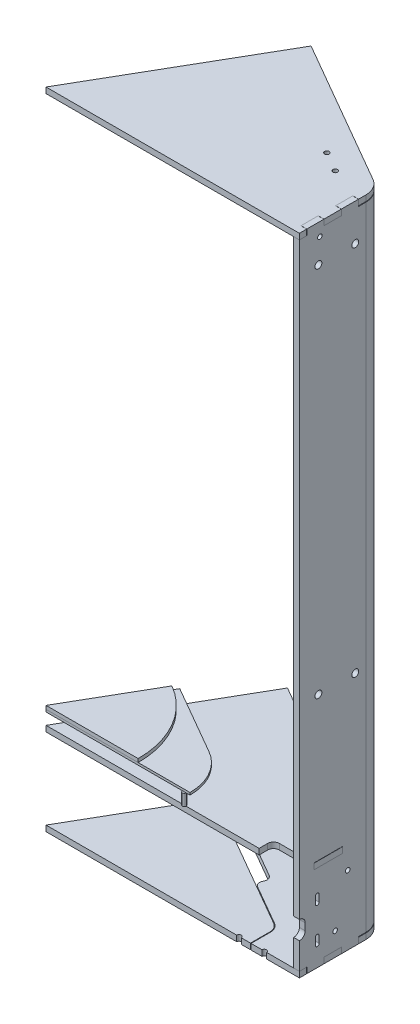
from build123d import *

# Parameters (mm, degrees)
SKETCH2_W             = 5
SKETCH2_H             = 350
BOSS_EXTRUDE1_START   = -95
BOSS_EXTRUDE1_DEPTH   = 5
FILLET1_R             = 17
THICKEN1_START        = -90
THICKEN1_DEPTH        = 550
BOSS_EXTRUDE7_DEPTH   = 5
SKETCH5_W             = 5
SKETCH5_H             = 15
CUT_EXTRUDE1_DEPTH    = 620.098738942
BOSS_EXTRUDE2_REACH   = 621.099
SKETCH7_W             = 5
SKETCH7_H             = 14.8
SKETCH22_W            = 35.037696658
SKETCH22_H            = 0.5
CUT_EXTRUDE8_DEPTH    = 535.703888671
BOSS_EXTRUDE3_DEPTH   = 3
BOSS_EXTRUDE4_DEPTH   = 2
SKETCH10_R            = 120
SKETCH10_R_2          = 80
CUT_EXTRUDE2_DEPTH    = 535.703888671
SKETCH11_R            = 1.625
BOSS_EXTRUDE5_DEPTH   = 10
BOSS_EXTRUDE6_DEPTH   = 5
CUT_EXTRUDE21_DEPTH   = 548.798547424
SKETCH13_W            = 25
SKETCH13_H            = 5.2
CUT_EXTRUDE4_DEPTH    = 535.703888671
CUT_EXTRUDE5_DEPTH    = 10
SKETCH21_R            = 2
CUT_EXTRUDE7_DEPTH    = 533.666169903
SKETCH24_W            = 121.884572681
SKETCH24_H            = 40
BOSS_EXTRUDE8_DEPTH   = 5
SKETCH24_H_2          = 74.75
BOSS_EXTRUDE8_2_DEPTH = 5
SKETCH27_R            = 2
SKETCH27_R_2          = 3
CUT_EXTRUDE10_DEPTH   = 5
SKETCH25_R            = 2
CUT_EXTRUDE9_DEPTH    = 615.579733281
SKETCH41_R            = 2
CUT_EXTRUDE22_DEPTH   = 620.098738942
CUT_EXTRUDE23_DEPTH   = 620.098738942
CUT_EXTRUDE6_DEPTH    = 10
FILLET2_R             = 5
SKETCH43_R            = 2
CUT_EXTRUDE24_DEPTH   = 620.098738942
SKETCH28_R            = 2
CUT_EXTRUDE11_DEPTH   = 620.098738942
SKETCH29_R            = 2
CUT_EXTRUDE12_DEPTH   = 506.811549291
SKETCH31_R            = 2
CUT_EXTRUDE14_DEPTH   = 548.798547424
SKETCH30_W            = 121.884572681
SKETCH30_H            = 549.5
SKETCH30_R            = 2
BOSS_EXTRUDE9_DEPTH   = 5
SKETCH32_W            = 40
SKETCH32_H            = 28
BOSS_EXTRUDE10_DEPTH  = 28
CUT_EXTRUDE15_DEPTH   = 522.844237142
SKETCH34_W            = 14.5
SKETCH34_H            = 24
CUT_EXTRUDE16_DEPTH   = 24
SKETCH35_R            = 2
CUT_EXTRUDE17_DEPTH   = 506.811549291
BOSS_EXTRUDE11_DEPTH  = 3
CHAMFER1_SIZE         = 2.75
BOSS_EXTRUDE12_DEPTH  = 0.5
CUT_EXTRUDE18_DEPTH   = 1
CHAMFER2_SIZE         = 0.25
CUT_EXTRUDE20_DEPTH   = 522.844237142


# Read off the part's stored shape, not the designer's step: Thicken1
with BuildPart() as part:
    # Sketch2 → Revolve1 (revolve)
    with BuildSketch(Plane(origin=(195, 0, 0), x_dir=(0, 0, -1), z_dir=(1, 0, 0))):
        with Locations((30, 275)):
            Rectangle(SKETCH2_W, SKETCH2_H)
    revolve(axis=Axis((195, 450, -32.5), (0, -1, 0)))


with BuildPart() as body_2:
    # Sketch3 → Boss-Extrude1 (new body)
    with BuildSketch(Plane(origin=(0, 0, 0), x_dir=(1, 0, 0), z_dir=(0, 1, 0)).offset(BOSS_EXTRUDE1_START)):
        Polygon((220, 67.5), (84.228357378, 145.887794416), (0, 0), (220, 0), (220, 32.5), align=None)
    extrude(amount=BOSS_EXTRUDE1_DEPTH)

    # Fillet1
    fillet1_edges = [body_2.edges().sort_by_distance(p)[0] for p in [
        (220, -92.5, -67.5),
    ]]
    fillet(fillet1_edges, radius=FILLET1_R)


with BuildPart() as body_3:
    # Thicken1 outline → Thicken1 (new body)
    with BuildSketch(Plane(origin=(0, 0, 0), x_dir=(1, 0, 0), z_dir=(0, 1, 0)).offset(THICKEN1_START)):
        with BuildLine():
            Line((215, 57.685045424), (215, 0))
            Line((215, 0), (220, 0))
            Line((220, 0), (220, 57.685045424))
            ThreePointArc((220, 57.685045424), (217.722431864, 66.185045424), (211.5, 72.407477288))
            Line((211.5, 72.407477288), (190, 84.820508076))
            Line((190, 84.820508076), (187.5, 80.490381057))
            Line((187.5, 80.490381057), (209, 68.077350269))
            ThreePointArc((209, 68.077350269), (213.392304845, 63.685045424), (215, 57.685045424))
        make_face()
    extrude(amount=THICKEN1_DEPTH)



with BuildPart() as body_4:
    # Sketch23 → Boss-Extrude7 (new body)
    with BuildSketch(Plane(origin=(0, 460, 0), x_dir=(1, 0, 0), z_dir=(0, 1, 0))):
        with BuildLine():
            Line((220, 0), (220, 57.685045424))
            ThreePointArc((220, 57.685045424), (217.722431864, 66.185045424), (211.5, 72.407477288))
            Line((211.5, 72.407477288), (84.228357378, 145.887794416))
            Line((84.228357378, 145.887794416), (0, 0))
            Line((0, 0), (220, 0))
        make_face()
    extrude(amount=BOSS_EXTRUDE7_DEPTH)


with BuildPart() as cut_extrude1_tool:
    # Sketch5 → Cut-Extrude1 (new, through all)
    with BuildSketch(Plane.XZ.offset(95)):
        with Locations((217.5, -43.842522712)):
            Rectangle(SKETCH5_W, SKETCH5_H)
        with Locations((217.5, -13.842522712)):
            Rectangle(SKETCH5_W, SKETCH5_H)
    extrude(amount=-CUT_EXTRUDE1_DEPTH)


with BuildPart() as body_2_1:
    add(body_2.part)

    # Cut-Extrude1: cut by cut_extrude1_tool
    add(cut_extrude1_tool.part, mode=Mode.SUBTRACT)

    # Sketch25 → Cut-Extrude9 (cut, through all)
    with BuildSketch(Plane(origin=(0, -90, 0), x_dir=(1, 0, 0), z_dir=(0, 1, 0))):
        with Locations(Location((200, 31, 0), (0, 0, 270))):
            Circle(SKETCH25_R)
        with Locations((189.5, 0)):
            Circle(SKETCH25_R)
        with Locations(Location((188.660254038, 62.5, 0), (0, 0, 270))):
            Circle(SKETCH25_R)
        with Locations(Location((171.339745962, 72.5, 0), (0, 0, 270))):
            Circle(SKETCH25_R)
    extrude(amount=-CUT_EXTRUDE9_DEPTH, mode=Mode.SUBTRACT)

    # Sketch41 → Cut-Extrude22 (cut, through all)
    with BuildSketch(Plane.XZ.offset(95)):
        with Locations((167.5, 0)):
            Circle(SKETCH41_R)
    extrude(amount=-CUT_EXTRUDE22_DEPTH, mode=Mode.SUBTRACT)

    # Sketch42 → Cut-Extrude23 (cut, through all)
    with BuildSketch(Plane.XZ.offset(95)):
        with BuildLine():
            Line((177.5, -16.693176311), (177.5, 0))
            Line((177.5, 0), (178, 0))
            Line((178, 0), (178, -16.693176311))
            ThreePointArc((178, -16.693176311), (176.660254038, -21.693176311), (173, -25.353430349))
            Line((173, -25.353430349), (54.228357378, -93.926270189))
            Line((54.228357378, -93.926270189), (53.978357378, -93.493257487))
            Line((53.978357378, -93.493257487), (172.75, -24.920417647))
            ThreePointArc((172.75, -24.920417647), (176.227241336, -21.443176311), (177.5, -16.693176311))
        make_face()
    extrude(amount=-CUT_EXTRUDE23_DEPTH, mode=Mode.SUBTRACT)


with BuildPart() as body_4_1:
    add(body_4.part)

    # Cut-Extrude1: cut by cut_extrude1_tool
    add(cut_extrude1_tool.part, mode=Mode.SUBTRACT)


with BuildPart() as body_3_1:
    add(body_3.part)

    # Boss-Extrude2: up to this face of the body (flat: up to its plane)
    boss_extrude2_end = Plane(body_4_1.part.faces().sort_by_distance((116.890310956, 465, -53.798845766))[0])
    # Sketch7 → Boss-Extrude2 (add, up to the picked face)
    with BuildSketch(Plane.XZ.offset(95), mode=Mode.PRIVATE) as boss_extrude2_sk1:
        with Locations((217.5, -13.842522712)):
            Rectangle(SKETCH7_W, SKETCH7_H)
    boss_extrude2_tool1 = split(extrude(boss_extrude2_sk1.sketch, amount=-BOSS_EXTRUDE2_REACH, mode=Mode.PRIVATE), bisect_by=boss_extrude2_end, keep=Keep.BOTH, mode=Mode.PRIVATE)
    # Sketch7 → Boss-Extrude2 (add, up to the picked face)
    with BuildSketch(Plane.XZ.offset(95), mode=Mode.PRIVATE) as boss_extrude2_sk2:
        with Locations((217.5, -43.842522712)):
            Rectangle(SKETCH7_W, SKETCH7_H)
    boss_extrude2_tool2 = split(extrude(boss_extrude2_sk2.sketch, amount=-BOSS_EXTRUDE2_REACH, mode=Mode.PRIVATE), bisect_by=boss_extrude2_end, keep=Keep.BOTH, mode=Mode.PRIVATE)
    add(boss_extrude2_tool1.solids().sort_by(Axis((217.5, -95, -13.842523), (0, 1, 0)))[0])
    add(boss_extrude2_tool2.solids().sort_by(Axis((217.5, -95, -43.842523), (0, 1, 0)))[0])

    # Sketch22 → Cut-Extrude8 (cut, through all)
    with BuildSketch(Plane(origin=(220, 0, 0), x_dir=(0, 0, -1), z_dir=(1, 0, 0))):
        with Locations((68.761371041, -89.75)):
            Rectangle(SKETCH22_W, SKETCH22_H)
        with Locations((68.761371041, 459.75)):
            Rectangle(SKETCH22_W, SKETCH22_H)
    extrude(amount=-CUT_EXTRUDE8_DEPTH, mode=Mode.SUBTRACT)

    # Sketch13 → Cut-Extrude4 (cut, through all)
    with BuildSketch(Plane(origin=(220, 0, 0), x_dir=(0, 0, -1), z_dir=(1, 0, 0))):
        with Locations((25, -17.4)):
            Rectangle(SKETCH13_W, SKETCH13_H)
    extrude(amount=-CUT_EXTRUDE4_DEPTH, mode=Mode.SUBTRACT)

    # Sketch14 → Cut-Extrude5 (cut)
    with BuildSketch(Plane(origin=(220, 0, 0), x_dir=(0, 0, -1), z_dir=(1, 0, 0))):
        with BuildLine():
            Line((13.875, -40.5), (13.875, -46.5))
            ThreePointArc((13.875, -46.5), (15.5, -48.125), (17.125, -46.5))
            Line((17.125, -46.5), (17.125, -40.5))
            ThreePointArc((17.125, -40.5), (15.5, -38.875), (13.875, -40.5))
        make_face()
        with BuildLine():
            Line((17.125, -71.5), (17.125, -77.5))
            ThreePointArc((17.125, -77.5), (15.5, -79.125), (13.875, -77.5))
            Line((13.875, -77.5), (13.875, -71.5))
            ThreePointArc((13.875, -71.5), (15.5, -69.875), (17.125, -71.5))
        make_face()
        with BuildLine():
            Line((5, -56), (5, -62))
            ThreePointArc((5, -62), (0, -67), (-5, -62))
            Line((-5, -62), (-5, -56))
            ThreePointArc((-5, -56), (0, -51), (5, -56))
        make_face()
    extrude(amount=-CUT_EXTRUDE5_DEPTH, mode=Mode.SUBTRACT)

    # Sketch21 → Cut-Extrude7 (cut, through all)
    with BuildSketch(Plane.ZY.offset(-215)):
        with Locations((-31, -75)):
            Circle(SKETCH21_R)
    extrude(amount=-CUT_EXTRUDE7_DEPTH, mode=Mode.SUBTRACT)

    # Sketch27 → Cut-Extrude10 (cut)
    with BuildSketch(Plane.ZY.offset(-215)):
        with Locations((-17.75, 453.5)):
            Circle(SKETCH27_R)
        with Locations((-42, -35)):
            Circle(SKETCH27_R)
        with Locations((-48.5, 433)):
            Circle(SKETCH27_R_2)
        with Locations((-16.5, 433)):
            Circle(SKETCH27_R_2)
        with Locations((-16.5, 110)):
            Circle(SKETCH27_R_2)
        with Locations((-48.5, 110)):
            Circle(SKETCH27_R_2)
    extrude(amount=-CUT_EXTRUDE10_DEPTH, mode=Mode.SUBTRACT)


with BuildPart() as body_5:
    # Sketch8 → Boss-Extrude3 (new body)
    with BuildSketch(Plane(origin=(0, 0, 0), x_dir=(1, 0, 0), z_dir=(0, 1, 0))):
        with BuildLine():
            Line((100, 34.641016151), (40, 69.282032303))
            Line((40, 69.282032303), (0, 0))
            Line((0, 0), (120, 0))
            ThreePointArc((120, 0), (114.641016151, 20), (100, 34.641016151))
        make_face()
    extrude(amount=-BOSS_EXTRUDE3_DEPTH)

    # Sketch10 → Cut-Extrude2 (cut, through all)
    with BuildSketch(Plane(origin=(0, 0, 0), x_dir=(1, 0, 0), z_dir=(0, 1, 0))):
        Circle(SKETCH10_R)
        Circle(SKETCH10_R_2, mode=Mode.SUBTRACT)
    extrude(amount=-CUT_EXTRUDE2_DEPTH, mode=Mode.SUBTRACT)


with BuildPart() as body_6:
    # Sketch9 → Boss-Extrude4 (new body)
    with BuildSketch(Plane.XZ.offset(3)):
        with BuildLine():
            Line((125, 0), (0, 0))
            Line((0, 0), (42.5, -73.612159322))
            Line((42.5, -73.612159322), (102.5, -38.97114317))
            ThreePointArc((102.5, -38.97114317), (118.97114317, -22.5), (125, 0))
        make_face()
    extrude(amount=BOSS_EXTRUDE4_DEPTH)


with BuildPart() as body_7:
    # Sketch11 → Boss-Extrude5 (new body)
    with BuildSketch(Plane.XZ.offset(5)):
        with Locations(Location((120, 0, 0), (0, 0, 270))):
            Circle(SKETCH11_R)
    extrude(amount=BOSS_EXTRUDE5_DEPTH)


with BuildPart() as body_8:
    # Sketch12 → Boss-Extrude6 (new body)
    with BuildSketch(Plane.XZ.offset(15)):
        Polygon((215, -53.06624327), (76.728357378, -132.89741336), (0, 0), (215, 0), (215, -12.5), (220, -12.5), (220, -37.5), (215, -37.5), align=None)
    extrude(amount=BOSS_EXTRUDE6_DEPTH)

    # Sketch40 → Cut-Extrude21 (cut, through all)
    with BuildSketch(Plane(origin=(0, -15, 0), x_dir=(1, 0, 0), z_dir=(0, 1, 0))):
        with BuildLine():
            Line((215, 12.5), (190, 12.5))
            ThreePointArc((190, 12.5), (186.464466094, 11.035533906), (185, 7.5))
            Line((185, 7.5), (185, 0))
            Line((185, 0), (215, 0))
            Line((215, 0), (215, 12.5))
        make_face()
    extrude(amount=-CUT_EXTRUDE21_DEPTH, mode=Mode.SUBTRACT)

    # Sketch31 → Cut-Extrude14 (cut, through all)
    with BuildSketch(Plane(origin=(0, -15, 0), x_dir=(1, 0, 0), z_dir=(0, 1, 0))):
        with Locations(Location((200, 42, 0), (0, 0, 270))):
            Circle(SKETCH31_R)
        with Locations(Location((145.358983849, 87.5, 0), (0, 0, 270))):
            Circle(SKETCH31_R)
    extrude(amount=-CUT_EXTRUDE14_DEPTH, mode=Mode.SUBTRACT)


with BuildPart() as body_9:
    # Sketch24 → Boss-Extrude8 (new body)
    with BuildSketch(Plane(origin=(84.228357378, 0, -145.887794416), x_dir=(-0.8660254037844382, 0, -0.5000000000000007), z_dir=(0.5000000000000008, 0, -0.8660254037844383))):
        with Locations((-60.942286341, 439.75)):
            Rectangle(SKETCH24_W, SKETCH24_H)
    extrude(amount=-BOSS_EXTRUDE8_DEPTH)


with BuildPart() as body_10:
    # Sketch24 → Boss-Extrude8 2 (new body)
    with BuildSketch(Plane(origin=(84.228357378, 0, -145.887794416), x_dir=(-0.8660254037844382, 0, -0.5000000000000007), z_dir=(0.5000000000000008, 0, -0.8660254037844383))):
        with Locations((-60.942286341, -52.375)):
            Rectangle(SKETCH24_W, SKETCH24_H_2)
    extrude(amount=-BOSS_EXTRUDE8_2_DEPTH)


with BuildPart() as cut_extrude23_piece_1:
    # of the separate pieces the step leaves, piece 1, a body of its own (cut_extrude23_pieces)
    add(body_2_1.part.solids().sort_by_distance((211.5, -95, -72.407477288))[0])

    # Sketch20 → Cut-Extrude6 (cut)
    with BuildSketch(Plane(origin=(0, -90, 0), x_dir=(1, 0, 0), z_dir=(0, 1, 0))):
        Polygon((67.888611416, 97.586524227), (139.019237886, 56.519237886), (134.019237886, 47.858983849), (62.888611416, 88.926270189), align=None)
    extrude(amount=-CUT_EXTRUDE6_DEPTH, mode=Mode.SUBTRACT)

    # Fillet2
    fillet2_edges = [cut_extrude23_piece_1.edges().sort_by_distance(p)[0] for p in [
        (67.888611416, -92.5, -97.586524227),
        (139.019237886, -92.5, -56.519237886),
    ]]
    fillet(fillet2_edges, radius=FILLET2_R)
    fillet2_2_edges = [cut_extrude23_piece_1.edges().sort_by_distance(p)[0] for p in [
        (62.888611416, -92.5, -88.926270189),
        (134.019237886, -92.5, -47.858983849),
    ]]
    fillet(fillet2_2_edges, radius=FILLET2_R - 0.0001)  # a hair under: the kernel refuses the full size


with BuildPart() as cut_extrude23_piece_2:
    # of the separate pieces the step leaves, piece 2, a body of its own (cut_extrude23_pieces)
    add(body_2_1.part.solids().sort_by_distance((53.978357378, -95, -93.493257487))[0])


with BuildPart() as cut_extrude24_tool:
    # Sketch43 → Cut-Extrude24 (new, through all)
    with BuildSketch(Plane.XZ.offset(95)):
        with Locations((59.103357378, -102.370017876)):
            Circle(SKETCH43_R)
        with Locations((49.103357378, -85.0495098)):
            Circle(SKETCH43_R)
    extrude(amount=-CUT_EXTRUDE24_DEPTH)


with BuildPart() as cut_extrude23_piece_1_1:
    add(cut_extrude23_piece_1.part)

    # Cut-Extrude24: cut by cut_extrude24_tool
    add(cut_extrude24_tool.part, mode=Mode.SUBTRACT)


with BuildPart() as cut_extrude23_piece_2_1:
    add(cut_extrude23_piece_2.part)

    # Cut-Extrude24: cut by cut_extrude24_tool
    add(cut_extrude24_tool.part, mode=Mode.SUBTRACT)


with BuildPart() as body_4_2:
    add(body_4_1.part)

    # Sketch28 → Cut-Extrude11 (cut, through all)
    with BuildSketch(Plane(origin=(0, 465, 0), x_dir=(1, 0, 0), z_dir=(0, 1, 0))):
        with Locations(Location((171.339745962, 72.5, 0), (0, 0, 270))):
            Circle(SKETCH28_R)
        with Locations(Location((188.660254038, 62.5, 0), (0, 0, 270))):
            Circle(SKETCH28_R)
    extrude(amount=-CUT_EXTRUDE11_DEPTH, mode=Mode.SUBTRACT)


with BuildPart() as cut_extrude12_tool:
    # Sketch29 → Cut-Extrude12 (new, through all)
    with BuildSketch(Plane(origin=(81.728357378, 0, -141.557667397), x_dir=(0.8660254037844384, 0, 0.5000000000000007), z_dir=(-0.5000000000000007, 0, 0.8660254037844384))):
        with Locations((112.134572681, -75)):
            Circle(SKETCH29_R)
        with Locations((82.134572681, -35)):
            Circle(SKETCH29_R)
        with Locations((112.134572681, 445)):
            Circle(SKETCH29_R)
        with BuildLine():
            Line((129.134572681, 447), (135.134572681, 447))
            ThreePointArc((135.134572681, 447), (137.134572681, 445), (135.134572681, 443))
            Line((135.134572681, 443), (129.134572681, 443))
            ThreePointArc((129.134572681, 443), (127.134572681, 445), (129.134572681, 447))
        make_face()
        with BuildLine():
            Line((129.134572681, -73), (135.134572681, -73))
            ThreePointArc((135.134572681, -73), (137.134572681, -75), (135.134572681, -77))
            Line((135.134572681, -77), (129.134572681, -77))
            ThreePointArc((129.134572681, -77), (127.134572681, -75), (129.134572681, -73))
        make_face()
    extrude(amount=-CUT_EXTRUDE12_DEPTH)


with BuildPart() as body_3_2:
    add(body_3_1.part)

    # Cut-Extrude12: cut by cut_extrude12_tool
    add(cut_extrude12_tool.part, mode=Mode.SUBTRACT)


with BuildPart() as body_9_1:
    add(body_9.part)

    # Cut-Extrude12: cut by cut_extrude12_tool
    add(cut_extrude12_tool.part, mode=Mode.SUBTRACT)


with BuildPart() as body_10_1:
    add(body_10.part)

    # Cut-Extrude12: cut by cut_extrude12_tool
    add(cut_extrude12_tool.part, mode=Mode.SUBTRACT)


with BuildPart() as body_12:
    # Sketch30 → Boss-Extrude9 (new body)
    with BuildSketch(Plane(origin=(84.228357378, 0, -145.887794416), x_dir=(-0.8660254037844384, 0, -0.5000000000000007), z_dir=(0.5000000000000007, 0, -0.8660254037844384))):
        with Locations((-60.942286341, 185)):
            Rectangle(SKETCH30_W, SKETCH30_H)
        with Locations((-112.134572681, 445)):
            Circle(SKETCH30_R, mode=Mode.SUBTRACT)
        with Locations((-112.134572681, -75)):
            Circle(SKETCH30_R, mode=Mode.SUBTRACT)
    extrude(amount=-BOSS_EXTRUDE9_DEPTH)


with BuildPart() as body_13:
    # Sketch32 → Boss-Extrude10 (new body)
    with BuildSketch(Plane(origin=(81.728357378, 0, -141.557667397), x_dir=(0.8660254037844382, 0, 0.5000000000000007), z_dir=(-0.5000000000000008, 0, 0.8660254037844383))):
        with Locations((122.134572681, -76)):
            Rectangle(SKETCH32_W, SKETCH32_H)
    extrude(amount=BOSS_EXTRUDE10_DEPTH)

    # Sketch33 → Cut-Extrude15 (cut, through all)
    with BuildSketch(Plane(origin=(88.451134547, 0, 51.067286341), x_dir=(-0.5000000000000009, 0, 0.8660254037844383), z_dir=(-0.8660254037844382, 0, -0.5000000000000008))):
        Polygon((-157.056714755, -62), (-157.056714755, -67.5), (-140.956714755, -83.6), (-135.456714755, -83.6), (-135.456714755, -62), align=None)
    extrude(amount=-CUT_EXTRUDE15_DEPTH, mode=Mode.SUBTRACT)

    # Sketch34 → Cut-Extrude16 (cut)
    with BuildSketch(Plane(origin=(67.728357378, 0, -117.308956091), x_dir=(0.866025403784438, 0, 0.5000000000000011), z_dir=(-0.5000000000000011, 0, 0.8660254037844382))):
        with Locations((112.384572681, -74)):
            Rectangle(SKETCH34_W, SKETCH34_H)
        with Locations((131.884572681, -74)):
            Rectangle(SKETCH34_W, SKETCH34_H)
    extrude(amount=-CUT_EXTRUDE16_DEPTH, mode=Mode.SUBTRACT)

    # Sketch35 → Cut-Extrude17 (cut, through all)
    with BuildSketch(Plane(origin=(81.728357378, 0, -141.557667397), x_dir=(-0.8660254037844379, 0, -0.5000000000000014), z_dir=(0.5000000000000013, 0, -0.8660254037844378))):
        with Locations((-112.134572681, -75)):
            Circle(SKETCH35_R)
        with Locations((-132.134572681, -75)):
            Circle(SKETCH35_R)
    extrude(amount=-CUT_EXTRUDE17_DEPTH, mode=Mode.SUBTRACT)

    # Sketch36 → Boss-Extrude11 (add)
    # profile 1 of 2: a face of its own
    with BuildSketch(Plane(origin=(79.728357378, 0, -138.093565782), x_dir=(0.866025403784438, 0, 0.5000000000000011), z_dir=(-0.5000000000000011, 0, 0.8660254037844382))):
        Polygon((138.759572681, -71.175054467), (132.134572681, -67.350108933), (125.509572681, -71.175054467), (125.509572681, -78.824945533), (132.134572681, -82.649891067), (138.759572681, -78.824945533), align=None)
        Polygon((132.134572681, -79.185789452), (135.759572681, -77.092894726), (135.759572681, -72.907105274), (132.134572681, -70.814210548), (128.509572681, -72.907105274), (128.509572681, -77.092894726), align=None, mode=Mode.SUBTRACT)
    # profile 2 of 2: a face of its own
    with BuildSketch(Plane(origin=(79.728357378, 0, -138.093565782), x_dir=(0.866025403784438, 0, 0.5000000000000011), z_dir=(-0.5000000000000011, 0, 0.8660254037844382))):
        Polygon((118.759572681, -71.175054467), (112.134572681, -67.350108933), (105.509572681, -71.175054467), (105.509572681, -78.824945533), (112.134572681, -82.649891067), (118.759572681, -78.824945533), align=None)
        Polygon((112.134572681, -79.185789452), (115.759572681, -77.092894726), (115.759572681, -72.907105274), (112.134572681, -70.814210548), (108.509572681, -72.907105274), (108.509572681, -77.092894726), align=None, mode=Mode.SUBTRACT)
    extrude(amount=BOSS_EXTRUDE11_DEPTH)

    # Chamfer1
    chamfer1_edges = [body_13.edges().sort_by_distance(p)[0] for p in [
        (195.528963188, -69.2625817, -67.77195323),
        (189.791544888, -69.2625817, -71.08445323),
        (186.922835738, -75, -72.74070323),
        (189.791544888, -80.7374183, -71.08445323),
        (195.528963188, -80.7374183, -67.77195323),
        (181.077164262, -75, -76.11570323),
        (178.208455112, -69.2625817, -77.77195323),
        (172.471036812, -69.2625817, -81.08445323),
        (169.602327662, -75, -82.74070323),
        (172.471036812, -80.7374183, -81.08445323),
        (178.208455112, -80.7374183, -77.77195323),
        (198.397672338, -75, -66.11570323),
    ]]
    chamfer(chamfer1_edges, length=CHAMFER1_SIZE)

    # Sketch38 → Boss-Extrude12 (add)
    # profile 1 of 2: a face of its own
    with BuildSketch(Plane(origin=(78.228357378, 0, -135.495489571), x_dir=(0.8660254037844383, 0, 0.5000000000000008), z_dir=(-0.5000000000000007, 0, 0.8660254037844382))):
        Polygon((115.759572681, -72.907105274), (112.134572681, -70.814210548), (108.509572681, -72.907105274), (108.509572681, -77.092894726), (112.134572681, -79.185789452), (115.759572681, -77.092894726), align=None)
        Polygon((115.509572681, -73.051442841), (112.134572681, -71.102885683), (108.759572681, -73.051442841), (108.759572681, -76.948557159), (112.134572681, -78.897114317), (115.509572681, -76.948557159), align=None, mode=Mode.SUBTRACT)
    # profile 2 of 2: a face of its own
    with BuildSketch(Plane(origin=(78.228357378, 0, -135.495489571), x_dir=(0.8660254037844383, 0, 0.5000000000000008), z_dir=(-0.5000000000000007, 0, 0.8660254037844382))):
        Polygon((132.134572681, -79.185789452), (135.759572681, -77.092894726), (135.759572681, -72.907105274), (132.134572681, -70.814210548), (128.509572681, -72.907105274), (128.509572681, -77.092894726), align=None)
        Polygon((132.134572681, -71.102885683), (128.759572681, -73.051442841), (128.759572681, -76.948557159), (132.134572681, -78.897114317), (135.509572681, -76.948557159), (135.509572681, -73.051442841), align=None, mode=Mode.SUBTRACT)
    extrude(amount=-BOSS_EXTRUDE12_DEPTH)

    # Sketch37 → Cut-Extrude18 (cut)
    with BuildSketch(Plane(origin=(79.728357378, 0, -138.093565782), x_dir=(0.866025403784438, 0, 0.5000000000000011), z_dir=(-0.5000000000000011, 0, 0.8660254037844382))):
        Polygon((108.509572681, -77.092894726), (112.134572681, -79.185789452), (115.759572681, -77.092894726), (115.759572681, -72.907105274), (112.134572681, -70.814210548), (108.509572681, -72.907105274), align=None)
        Polygon((128.509572681, -77.092894726), (132.134572681, -79.185789452), (135.759572681, -77.092894726), (135.759572681, -72.907105274), (132.134572681, -70.814210548), (128.509572681, -72.907105274), align=None)
    extrude(amount=-CUT_EXTRUDE18_DEPTH, mode=Mode.SUBTRACT)

    # Chamfer2
    chamfer2_edges = [body_13.edges().sort_by_distance(p)[0] for p in [
        (178.2625817, -75, -77.74070323),
        (176.801163831, -77.922835738, -78.58445323),
        (173.878328093, -77.922835738, -80.27195323),
        (172.416910224, -75, -81.11570323),
        (173.878328093, -72.077164262, -80.27195323),
        (176.801163831, -72.077164262, -78.58445323),
        (194.121671907, -72.077164262, -68.58445323),
        (195.583089776, -75, -67.74070323),
        (194.121671907, -77.922835738, -68.58445323),
        (191.198836169, -77.922835738, -70.27195323),
        (189.7374183, -75, -71.11570323),
        (191.198836169, -72.077164262, -70.27195323),
    ]]
    chamfer(chamfer2_edges, length=CHAMFER2_SIZE)

    # Sketch39 → Cut-Extrude20 (cut, through all)
    with BuildSketch(Plane(origin=(88.451134547, 0, 51.067286341), x_dir=(-0.5000000000000009, 0, 0.8660254037844383), z_dir=(-0.8660254037844382, 0, -0.5000000000000008))):
        Polygon((-163.456714755, -90), (-135.456714755, -62), (-135.456714755, -90), align=None)
    extrude(amount=-CUT_EXTRUDE20_DEPTH, mode=Mode.SUBTRACT)

    # Mirror1: body 13 across plane


with BuildPart() as body_13_1:
    add(body_13.part)
    add(body_13.part.mirror(Plane(origin=(247.432003018, -90, -45.888622981), x_dir=(0.2738612787525833, 0.5477225575051657, 0.7905694150420951), z_dir=(0.35355339059327434, 0.7071067811865475, -0.6123724356957942))))


solid = Compound([part.part, body_5.part, body_6.part, body_7.part, body_8.part, cut_extrude23_piece_1_1.part, cut_extrude23_piece_2_1.part, body_4_2.part, body_3_2.part, body_9_1.part, body_10_1.part, body_12.part, body_13_1.part])
